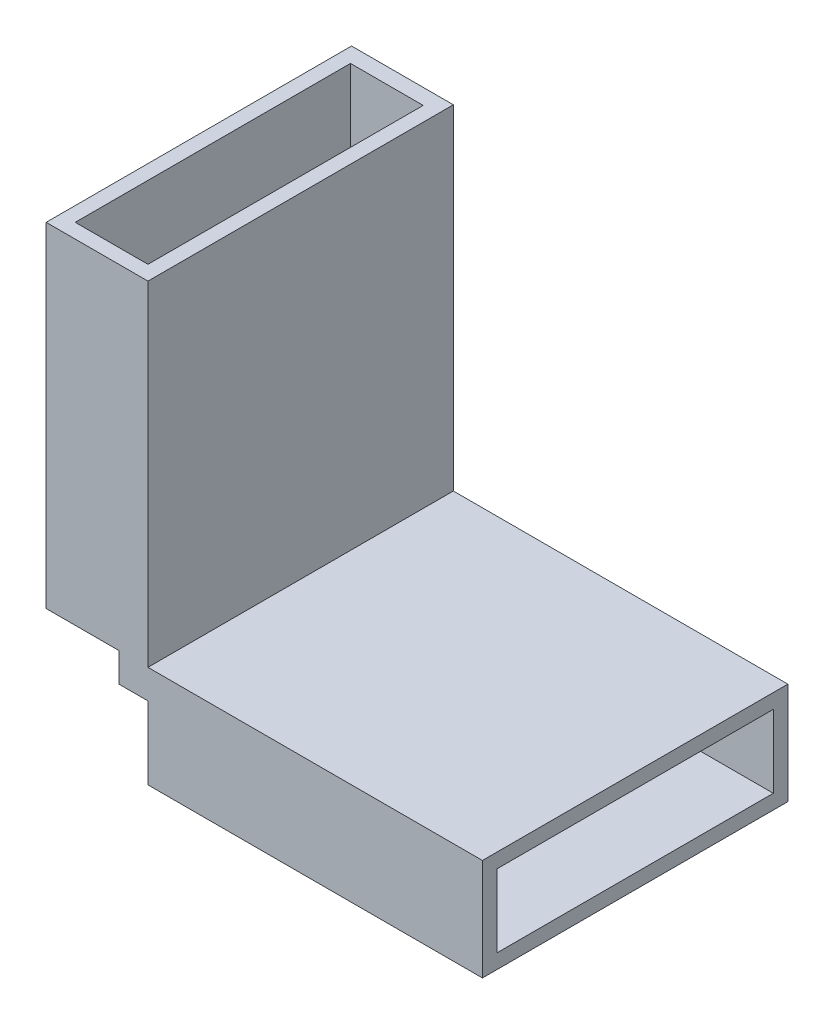
from build123d import *

# Parameters (mm, degrees)
SKETCH1_W           = 30
SKETCH1_H           = 30
BOSS_EXTRUDE1_DEPTH = 7
SKETCH2_W           = 7
SKETCH2_H           = 23
BOSS_EXTRUDE4_DEPTH = 20
SKETCH4_W           = 2
SKETCH4_H           = 2
BOSS_EXTRUDE6_DEPTH = 20
SKETCH5_W           = 23
SKETCH5_H           = 7
BOSS_EXTRUDE7_DEPTH = 20
SHELL2_START        = 8
SHELL2_DEPTH        = 22
SHELL2_START_2      = 1
SHELL2_2_DEPTH      = 5
SHELL2_START_3      = 6
SHELL2_3_OUTLINE_W  = 29
SHELL2_3_OUTLINE_H  = 5
SHELL2_3_DEPTH      = 2
SKETCH7_W           = 23
SKETCH7_H           = 1
BOSS_EXTRUDE8_DEPTH = 5
SKETCH9_W           = 1.075143629
SKETCH9_H           = 23
BOSS_EXTRUDE9_DEPTH = 5
SKETCH10_W          = 30
SKETCH10_H          = 30
CUT_EXTRUDE1_DEPTH  = 6
CUT_EXTRUDE2_DEPTH  = 6
SKETCH12_W          = 23
SKETCH12_H          = 23
CUT_EXTRUDE3_DEPTH  = 6


# Read off the part's stored shape, not the designer's step: Shell2
with BuildPart() as part:
    # Sketch1 → Boss-Extrude1 (new body)
    with BuildSketch(Plane.XY):
        with Locations((15, 15)):
            Rectangle(SKETCH1_W, SKETCH1_H)
    extrude(amount=BOSS_EXTRUDE1_DEPTH)

    # Sketch2 → Boss-Extrude4 (add)
    with BuildSketch(Plane.XY.offset(7)):
        with Locations((3.5, 18.5)):
            Rectangle(SKETCH2_W, SKETCH2_H)
    extrude(amount=BOSS_EXTRUDE4_DEPTH)

    # Sketch4 → Boss-Extrude6 (add)
    with BuildSketch(Plane.XY.offset(7)):
        with Locations((6, 6)):
            Rectangle(SKETCH4_W, SKETCH4_H)
    extrude(amount=BOSS_EXTRUDE6_DEPTH)

    # Sketch5 → Boss-Extrude7 (add)
    with BuildSketch(Plane.XY.offset(7)):
        with Locations((18.5, 3.5)):
            Rectangle(SKETCH5_W, SKETCH5_H)
    extrude(amount=BOSS_EXTRUDE7_DEPTH)

    # Shell2 outline → Shell2 (cut)
    with BuildSketch(Plane(origin=(0, 0, 0), x_dir=(1, 0, 0), z_dir=(0, 1, 0)).offset(SHELL2_START)):
        Polygon((6, -6), (30, -6), (30, -1), (1, -1), (1, -26), (6, -26), align=None)
    extrude(amount=SHELL2_DEPTH, mode=Mode.SUBTRACT)

    # Shell2 2 outline → Shell2 2 (cut)
    with BuildSketch(Plane(origin=(0, 0, 0), x_dir=(1, 0, 0), z_dir=(0, 1, 0)).offset(SHELL2_START_2)):
        Polygon((8, -6), (8, -26), (30, -26), (30, -1), (1, -1), (1, -6), align=None)
    extrude(amount=SHELL2_2_DEPTH, mode=Mode.SUBTRACT)

    # Shell2 3 outline → Shell2 3 (cut)
    with BuildSketch(Plane(origin=(0, 0, 0), x_dir=(1, 0, 0), z_dir=(0, 1, 0)).offset(SHELL2_START_3)):
        with Locations((15.5, -3.5)):
            Rectangle(SHELL2_3_OUTLINE_W, SHELL2_3_OUTLINE_H)
    extrude(amount=SHELL2_3_DEPTH, mode=Mode.SUBTRACT)

    # Sketch7 → Boss-Extrude8 (add)
    with BuildSketch(Plane.XZ.offset(-6)):
        with Locations((18.5, 6.5)):
            Rectangle(SKETCH7_W, SKETCH7_H)
    extrude(amount=BOSS_EXTRUDE8_DEPTH)

    # Sketch9 → Boss-Extrude9 (add)
    with BuildSketch(Plane.ZY.offset(-6)):
        with Locations((6.537571814, 18.5)):
            Rectangle(SKETCH9_W, SKETCH9_H)
    extrude(amount=BOSS_EXTRUDE9_DEPTH)

    # Sketch10 → Cut-Extrude1 (cut)
    with BuildSketch(Plane(origin=(0, 0, 0), x_dir=(-1, 0, 0), z_dir=(0, 0, -1))):
        with Locations((-15, 15)):
            Rectangle(SKETCH10_W, SKETCH10_H)
    extrude(amount=-CUT_EXTRUDE1_DEPTH, mode=Mode.SUBTRACT)

    # Sketch11 → Cut-Extrude2 (cut)
    with BuildSketch(Plane.XY.offset(7)):
        Polygon((7, 0), (7, 5), (5, 5), (5, 7), (0, 7), (0, 0), align=None)
    extrude(amount=-CUT_EXTRUDE2_DEPTH, mode=Mode.SUBTRACT)

    # Sketch12 → Cut-Extrude3 (cut)
    with BuildSketch(Plane.XY.offset(7)):
        with Locations((18.5, 18.5)):
            Rectangle(SKETCH12_W, SKETCH12_H)
    extrude(amount=-CUT_EXTRUDE3_DEPTH, mode=Mode.SUBTRACT)


solid = part.part
